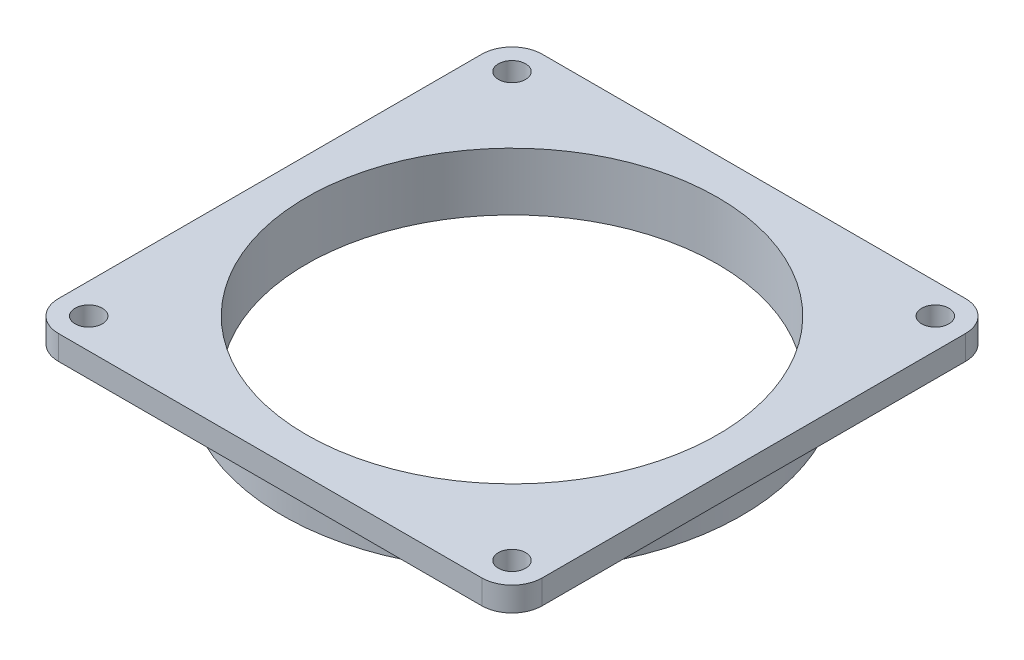
from build123d import *

# Parameters (mm, degrees)
SKETCH1_R           = 38
SKETCH1_R_2         = 34
BOSS_EXTRUDE1_DEPTH = 5.5626
SKETCH3_W           = 80
SKETCH3_H           = 80
SKETCH3_R           = 2.25
SKETCH3_R_2         = 34
BOSS_EXTRUDE5_DEPTH = 4
FILLET2_R           = 5


with BuildPart() as part:
    # Sketch1 → Boss-Extrude1 (new body)
    with BuildSketch(Plane(origin=(0, 0, 0), x_dir=(1, 0, 0), z_dir=(0, 1, 0))):
        Circle(SKETCH1_R)
        Circle(SKETCH1_R_2, mode=Mode.SUBTRACT)
    extrude(amount=BOSS_EXTRUDE1_DEPTH)

    # Sketch3 → Boss-Extrude5 (add)
    with BuildSketch(Plane(origin=(0, 5.5626, 0), x_dir=(1, 0, 0), z_dir=(0, 1, 0))):
        Rectangle(SKETCH3_W, SKETCH3_H)
        with Locations((-35, -35)):
            Circle(SKETCH3_R, mode=Mode.SUBTRACT)
        with Locations((35, -35)):
            Circle(SKETCH3_R, mode=Mode.SUBTRACT)
        with Locations((35, 35)):
            Circle(SKETCH3_R, mode=Mode.SUBTRACT)
        with Locations((-35, 35)):
            Circle(SKETCH3_R, mode=Mode.SUBTRACT)
        Circle(SKETCH3_R_2, mode=Mode.SUBTRACT)
    extrude(amount=BOSS_EXTRUDE5_DEPTH)

    # Fillet2
    fillet2_edges = [part.edges().sort_by_distance(p)[0] for p in [
        (-40, 7.5626, -40),
        (40, 7.5626, -40),
        (40, 7.5626, 40),
        (-40, 7.5626, 40),
    ]]
    fillet(fillet2_edges, radius=FILLET2_R)


solid = part.part
